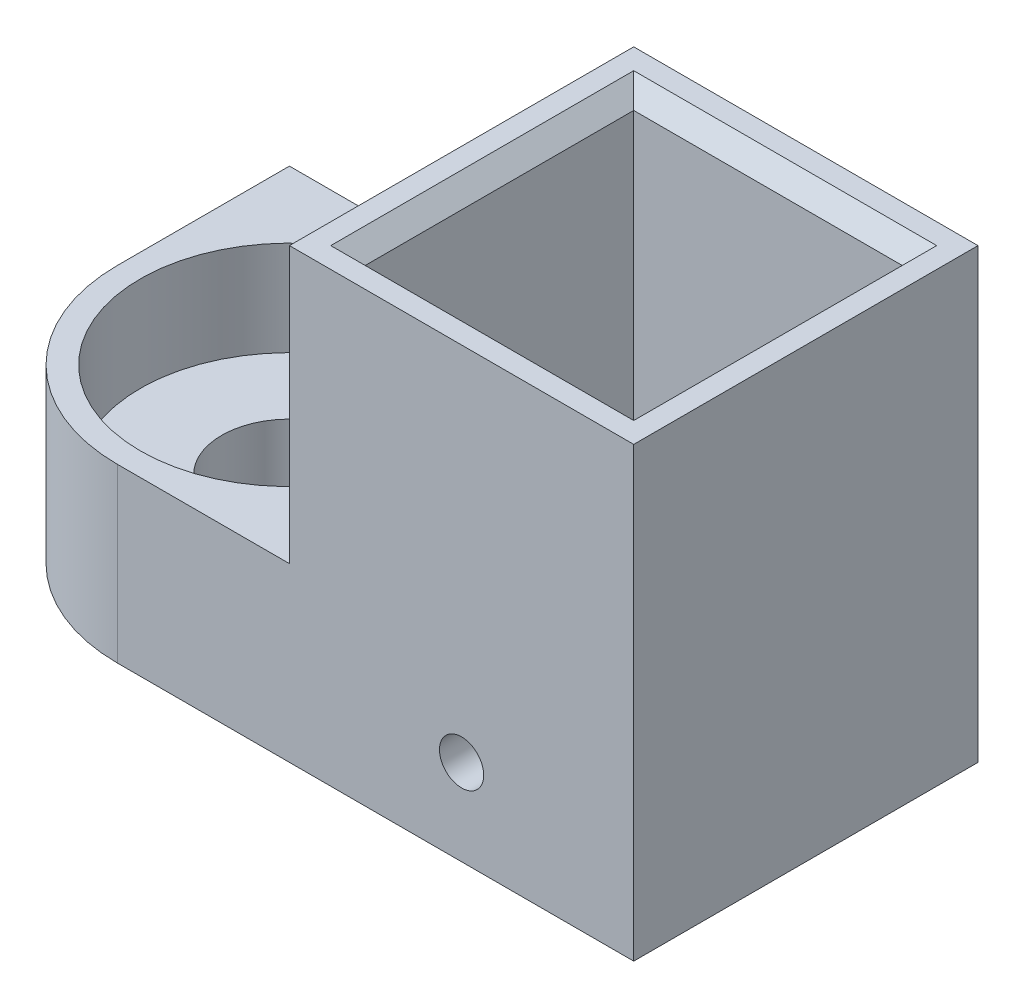
from build123d import *

# Parameters (mm, degrees)
SKETCH1_W             = 25.4
SKETCH1_H             = 25.4
SKETCH1_W_2           = 19.812
SKETCH1_H_2           = 19.812
BOSS_EXTRUDE1_DEPTH   = 33.02
SKETCH9_W             = 25.4
SKETCH9_H             = 25.4
BOSS_EXTRUDE5_DEPTH   = 12.7
SKETCH14_W            = 19.812
SKETCH14_H            = 19.812
SKETCH14_W_2          = 16.002
SKETCH14_H_2          = 16.002
BOSS_EXTRUDE6_DEPTH   = 2.54
SKETCH10_R            = 11
CUT_EXTRUDE1_DEPTH    = 7
CUT_EXTRUDE2_REACH    = 50.572
SKETCH15_R            = 5
SKETCH17_W            = 25.4
SKETCH17_H            = 25.4
BOSS_EXTRUDE7_DEPTH   = 6.35
CUT_EXTRUDE4_REACH    = 65.194
SKETCH18_R            = 6.5
CIRPATTERN1_COUNT     = 4
SKETCH23_R            = 3.2500062
CUT_EXTRUDE5_DEPTH    = 2.75
CIRPATTERN2_COUNT     = 4
FILLET3_R             = 12.7
FILLET4_R             = 1.27
FILLET5_R             = 1.27
F_4_CLEARANCE_HOLE1_D = 3.2639
CHAMFER1_SIZE         = 1.27


with BuildPart() as part:
    # Sketch1 → Boss-Extrude1 (new body)
    with BuildSketch(Plane(origin=(0, 0, 0), x_dir=(1, 0, 0), z_dir=(0, 1, 0))):
        Rectangle(SKETCH1_W, SKETCH1_H)
        Rectangle(SKETCH1_W_2, SKETCH1_H_2, mode=Mode.SUBTRACT)
    extrude(amount=BOSS_EXTRUDE1_DEPTH)

    # Sketch9 → Boss-Extrude5 (add)
    with BuildSketch(Plane.XZ):
        with Locations((-25.4, 0)):
            Rectangle(SKETCH9_W, SKETCH9_H)
    extrude(amount=-BOSS_EXTRUDE5_DEPTH)

    # Sketch14 → Boss-Extrude6 (add)
    with BuildSketch(Plane.XZ):
        Rectangle(SKETCH14_W, SKETCH14_H)
        Rectangle(SKETCH14_W_2, SKETCH14_H_2, mode=Mode.SUBTRACT)
    extrude(amount=-BOSS_EXTRUDE6_DEPTH)

    # Sketch10 → Cut-Extrude1 (cut)
    with BuildSketch(Plane(origin=(0, 12.7, 0), x_dir=(1, 0, 0), z_dir=(0, 1, 0))):
        with Locations(Location((-25.4, 0, 0), (0, 0, 270))):
            Circle(SKETCH10_R)
    extrude(amount=-CUT_EXTRUDE1_DEPTH, mode=Mode.SUBTRACT)

    # Sketch15 → Cut-Extrude2 (cut, up to next)
    with BuildSketch(Plane(origin=(0, 5.7, 0), x_dir=(1, 0, 0), z_dir=(0, 1, 0)), mode=Mode.PRIVATE) as cut_extrude2_sk1:
        with Locations(Location((-25.4, 0, 0), (0, 0, 270))):
            Circle(SKETCH15_R)
    cut_extrude2_tool1 = extrude(cut_extrude2_sk1.sketch, amount=-CUT_EXTRUDE2_REACH, mode=Mode.PRIVATE) & part.part
    add(cut_extrude2_tool1.solids().sort_by_distance((-25.4, 5.7, 0))[0], mode=Mode.SUBTRACT)

    # Sketch17 → Boss-Extrude7 (add)
    with BuildSketch(Plane.XZ):
        with Locations((-25.4, -25.4)):
            Rectangle(SKETCH17_W, SKETCH17_H)
    extrude(amount=-BOSS_EXTRUDE7_DEPTH)

    # Sketch18 → Cut-Extrude4 (cut, up to next)
    with BuildSketch(Plane.XZ, mode=Mode.PRIVATE) as cut_extrude4_sk1:
        with Locations(Location((-25.4, -25.4, 0), (0, 0, 270))):
            Circle(SKETCH18_R)
    cut_extrude4_tool1 = extrude(cut_extrude4_sk1.sketch, amount=-CUT_EXTRUDE4_REACH, mode=Mode.PRIVATE) & part.part
    add(cut_extrude4_tool1.solids().sort_by_distance((-25.4, 0, -25.4))[0], mode=Mode.SUBTRACT)

    # Sketch22 → M3 Clearance Hole1 (revolve, cut)
    with BuildSketch(Plane(origin=(-16.4, 0, -25.4), x_dir=(0, 0, -1), z_dir=(1, 0, 0))):
        Polygon((0, 0), (0, 13.721463052), (1.7, 12.7), (1.7, 0), align=None)
    m3_clearance_hole1 = revolve(axis=Axis((-16.4, -6.35, -25.4), (0, 1, 0)), mode=Mode.SUBTRACT)

    # CirPattern1: M3 Clearance Hole1 ×4 about axis
    cirpattern1_axis = Axis((-25.4, 0, -25.4), (0, 1, 0))
    for i in range(1, CIRPATTERN1_COUNT):
        add(m3_clearance_hole1.rotate(cirpattern1_axis, i * 360 / CIRPATTERN1_COUNT), mode=Mode.SUBTRACT)

    # Sketch23 → Cut-Extrude5 (cut)
    with BuildSketch(Plane(origin=(0, 6.35, 0), x_dir=(1, 0, 0), z_dir=(0, 1, 0))):
        with Locations((-25.4, 34.4)):
            Circle(SKETCH23_R)
    cut_extrude5 = extrude(amount=-CUT_EXTRUDE5_DEPTH, mode=Mode.SUBTRACT)

    # CirPattern2: Cut-Extrude5 ×4 about axis
    cirpattern2_axis = Axis((-25.4, 0, -25.4), (0, 1, 0))
    for i in range(1, CIRPATTERN2_COUNT):
        add(cut_extrude5.rotate(cirpattern2_axis, i * 360 / CIRPATTERN2_COUNT), mode=Mode.SUBTRACT)

    # Fillet3
    fillet3_edges = [part.edges().sort_by_distance(p)[0] for p in [
        (-38.1, 3.175, -38.1),
        (-12.7, 3.175, -38.1),
        (-38.1, 6.35, 12.7),
    ]]
    fillet(fillet3_edges, radius=FILLET3_R - 0.0001)  # a hair under: the kernel refuses the full size

    # Fillet4
    fillet4_edges = [part.edges().sort_by_distance(p)[0] for p in [
        (-8.001, 1.27, 8.001),
        (8.001, 1.27, 8.001),
        (8.001, 1.27, -8.001),
        (-8.001, 1.27, -8.001),
    ]]
    fillet(fillet4_edges, radius=FILLET4_R)

    # Fillet5
    fillet5_edges = [part.edges().sort_by_distance(p)[0] for p in [
        (-7.629025612, 2.54, -7.629025612),
        (-8.001, 2.54, 0),
        (-7.629025612, 2.54, 7.629025612),
        (0, 2.54, 8.001),
        (7.629025612, 2.54, 7.629025612),
        (8.001, 2.54, 0),
        (7.629025612, 2.54, -7.629025612),
        (-7.629025612, 0, -7.629025612),
        (-8.001, 0, 0),
        (-7.629025612, 0, 7.629025612),
        (0, 0, 8.001),
        (7.629025612, 0, 7.629025612),
        (8.001, 0, 0),
        (7.629025612, 0, -7.629025612),
        (0, 2.54, -8.001),
        (0, 0, -8.001),
    ]]
    fillet(fillet5_edges, radius=FILLET5_R - 0.0001)  # a hair under: the kernel refuses the full size

    # #4 Clearance Hole1 (through all)
    with Locations(Plane.XY.offset(12.7)):
        with Locations((0, 6.35)):
            Hole(F_4_CLEARANCE_HOLE1_D / 2)

    # Chamfer1
    chamfer1_edges = [part.edges().sort_by_distance(p)[0] for p in [
        (9.906, 33.02, 0),
        (0, 33.02, -9.906),
        (-9.906, 33.02, 0),
        (0, 33.02, 9.906),
    ]]
    chamfer(chamfer1_edges, length=CHAMFER1_SIZE)


solid = part.part
